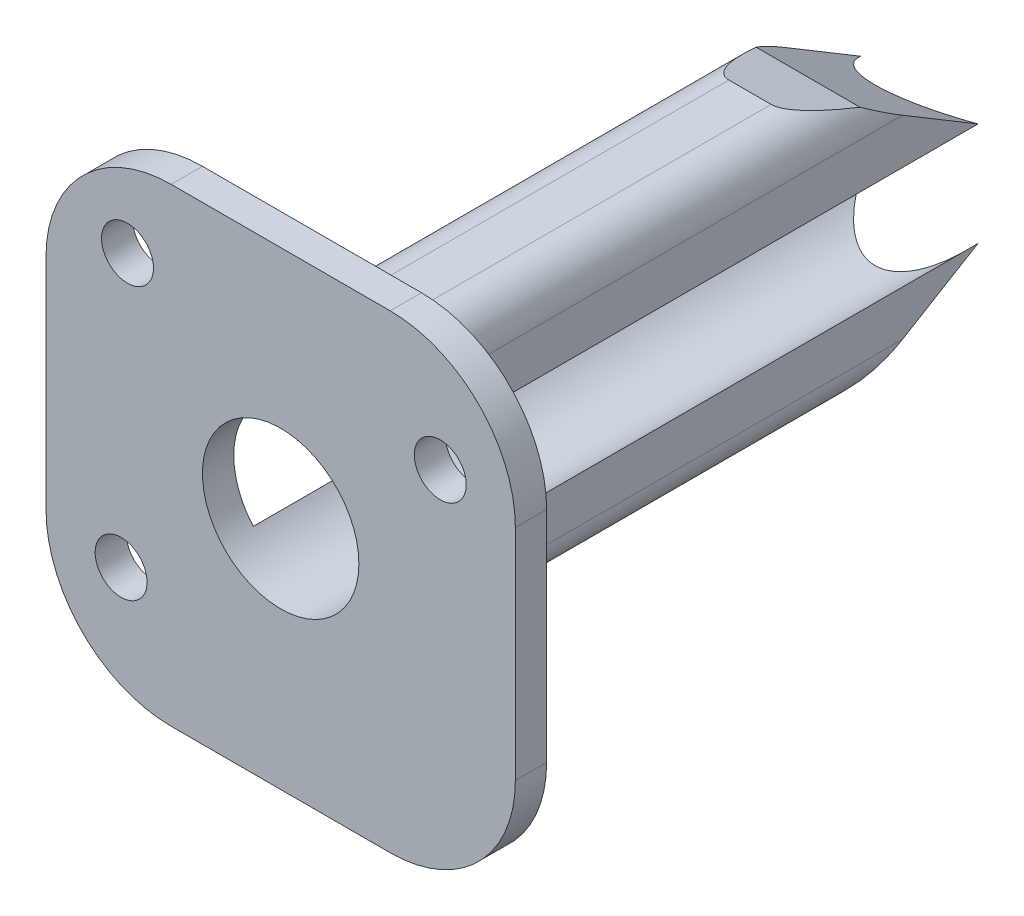
from build123d import *

# Parameters (mm, degrees)
CROQUIS2_W              = 75
CROQUIS2_H              = 75
SALIENTE_EXTRUIR1_DEPTH = 5
SALIENTE_EXTRUIR2_DEPTH = 100
CHAFL_N1_SIZE           = 25
CHAFL_N1_SIZE_2         = 15
CHAFL_N2_SIZE           = 25
CHAFL_N2_SIZE_2         = 15
CORTAR_EXTRUIR1_REACH   = 112.598
CHAFL_N3_SIZE           = 5
REDONDEO1_R             = 6
REDONDEO2_R             = 20
SKETCH1_R               = 4.15
CUT_EXTRUDE2_DEPTH      = 10


with BuildPart() as part:
    # Croquis2 → Saliente-Extruir1 (new body)
    with BuildSketch(Plane(origin=(0, 0, 0), x_dir=(0, 1, 0), z_dir=(0, 0, 1))):
        Rectangle(CROQUIS2_W, CROQUIS2_H)
    extrude(amount=SALIENTE_EXTRUIR1_DEPTH)

    # Croquis2<3> → Saliente-Extruir2 (add)
    with BuildSketch(Plane(origin=(0, 0, 0), x_dir=(0, 1, 0), z_dir=(0, 0, 1))):
        with BuildLine():
            Line((-21.5, 9.375), (-21.5, -9.375))
            Line((-21.5, -9.375), (-8.267972847, -9.375))
            ThreePointArc((-8.267972847, -9.375), (-12.5, 0), (-8.267972847, 9.375))
            Line((-8.267972847, 9.375), (-21.5, 9.375))
        make_face()
        with BuildLine():
            ThreePointArc((8.267972847, 9.375), (12.5, 0), (8.267972847, -9.375))
            Line((8.267972847, -9.375), (21.5, -9.375))
            Line((21.5, -9.375), (21.5, 9.375))
            Line((21.5, 9.375), (8.267972847, 9.375))
        make_face()
    extrude(amount=-SALIENTE_EXTRUIR2_DEPTH)

    # Chaflán1
    # the kernel refuses this chamfer: 25, 15 mm, written as the material it takes off along each edge
    with BuildSketch(Plane(origin=(74.03152743, 21.5, -100), x_dir=(0, 0.01989341895858247, 0.9998021063601227), z_dir=(-1, 0, 0))) as chafl_n1_piece_1:
        Polygon((CHAFL_N1_SIZE * 0.99980210636, -CHAFL_N1_SIZE * 0.0198934189586), (-CHAFL_N1_SIZE_2 * 0.0198934189586, -CHAFL_N1_SIZE_2 * 0.99980210636), (0, 0), align=None)
    extrude(amount=148.06305486, mode=Mode.SUBTRACT)

    # Chaflán2
    # the kernel refuses this chamfer: 25, 15 mm, written as the material it takes off along each edge
    with BuildSketch(Plane(origin=(-74.03152743, -21.5, -100), x_dir=(0, -0.01989341895858247, 0.9998021063601227), z_dir=(1, 0, 0))) as chafl_n2_piece_1:
        Polygon((CHAFL_N2_SIZE * 0.99980210636, -CHAFL_N2_SIZE * 0.0198934189586), (-CHAFL_N2_SIZE_2 * 0.0198934189586, -CHAFL_N2_SIZE_2 * 0.99980210636), (0, 0), align=None)
    extrude(amount=148.06305486, mode=Mode.SUBTRACT)

    # Croquis2<4> → Cortar-Extruir1 (cut, up to next)
    with BuildSketch(Plane(origin=(0, 0, 0), x_dir=(0, 1, 0), z_dir=(0, 0, 1)), mode=Mode.PRIVATE) as cortar_extruir1_sk1:
        with BuildLine():
            ThreePointArc((-8.267972847, 9.375), (-12.5, 0), (-8.267972847, -9.375))
            Line((-8.267972847, -9.375), (8.267972847, -9.375))
            ThreePointArc((8.267972847, -9.375), (11.392972847, -5.142972847), (12.5, 0))
            ThreePointArc((12.5, 0), (11.392972847, 5.142972847), (8.267972847, 9.375))
            Line((8.267972847, 9.375), (-8.267972847, 9.375))
        make_face()
    cortar_extruir1_tool1 = extrude(cortar_extruir1_sk1.sketch, amount=CORTAR_EXTRUIR1_REACH, mode=Mode.PRIVATE) & part.part
    # Croquis2<4> → Cortar-Extruir1 (cut, up to next)
    with BuildSketch(Plane(origin=(0, 0, 0), x_dir=(0, 1, 0), z_dir=(0, 0, 1)), mode=Mode.PRIVATE) as cortar_extruir1_sk2:
        with BuildLine():
            Line((8.267972847, -9.375), (-8.267972847, -9.375))
            ThreePointArc((-8.267972847, -9.375), (0, -12.5), (8.267972847, -9.375))
        make_face()
    cortar_extruir1_tool2 = extrude(cortar_extruir1_sk2.sketch, amount=CORTAR_EXTRUIR1_REACH, mode=Mode.PRIVATE) & part.part
    # Croquis2<4> → Cortar-Extruir1 (cut, up to next)
    with BuildSketch(Plane(origin=(0, 0, 0), x_dir=(0, 1, 0), z_dir=(0, 0, 1)), mode=Mode.PRIVATE) as cortar_extruir1_sk3:
        with BuildLine():
            ThreePointArc((8.267972847, 9.375), (0, 12.5), (-8.267972847, 9.375))
            Line((-8.267972847, 9.375), (8.267972847, 9.375))
        make_face()
    cortar_extruir1_tool3 = extrude(cortar_extruir1_sk3.sketch, amount=CORTAR_EXTRUIR1_REACH, mode=Mode.PRIVATE) & part.part
    add(cortar_extruir1_tool1.solids().sort_by_distance((0, 0, 0))[0], mode=Mode.SUBTRACT)
    add(cortar_extruir1_tool2.solids().sort_by_distance((10.639442, 0, 0))[0], mode=Mode.SUBTRACT)
    add(cortar_extruir1_tool3.solids().sort_by_distance((-10.639442, 0, 0))[0], mode=Mode.SUBTRACT)

    # Chaflán3
    chafl_n3_edges = [part.edges().sort_by_distance(p)[0] for p in [
        (0, 21.5, -75),
        (0, -21.5, -75),
    ]]
    chamfer(chafl_n3_edges, length=CHAFL_N3_SIZE)

    # Redondeo1
    redondeo1_edges = [part.edges().sort_by_distance(p)[0] for p in [
        (-9.375, -21.5, -35),
        (9.375, -21.5, -35),
        (9.375, 21.5, -35),
        (-9.375, 21.5, -35),
    ]]
    fillet(redondeo1_edges, radius=REDONDEO1_R)

    # Redondeo2
    redondeo2_edges = [part.edges().sort_by_distance(p)[0] for p in [
        (37.5, 37.5, 2.5),
        (37.5, -37.5, 2.5),
        (-37.5, -37.5, 2.5),
        (-37.5, 37.5, 2.5),
    ]]
    fillet(redondeo2_edges, radius=REDONDEO2_R)

    # Sketch1 → Cut-Extrude2 (cut)
    with BuildSketch(Plane.XY.offset(5)):
        with Locations((25.5, 19.5)):
            Circle(SKETCH1_R)
        with Locations((-24.48, 24.48)):
            Circle(SKETCH1_R)
        with Locations((-25.5, -19.5)):
            Circle(SKETCH1_R)
    extrude(amount=-CUT_EXTRUDE2_DEPTH, mode=Mode.SUBTRACT)


solid = part.part
